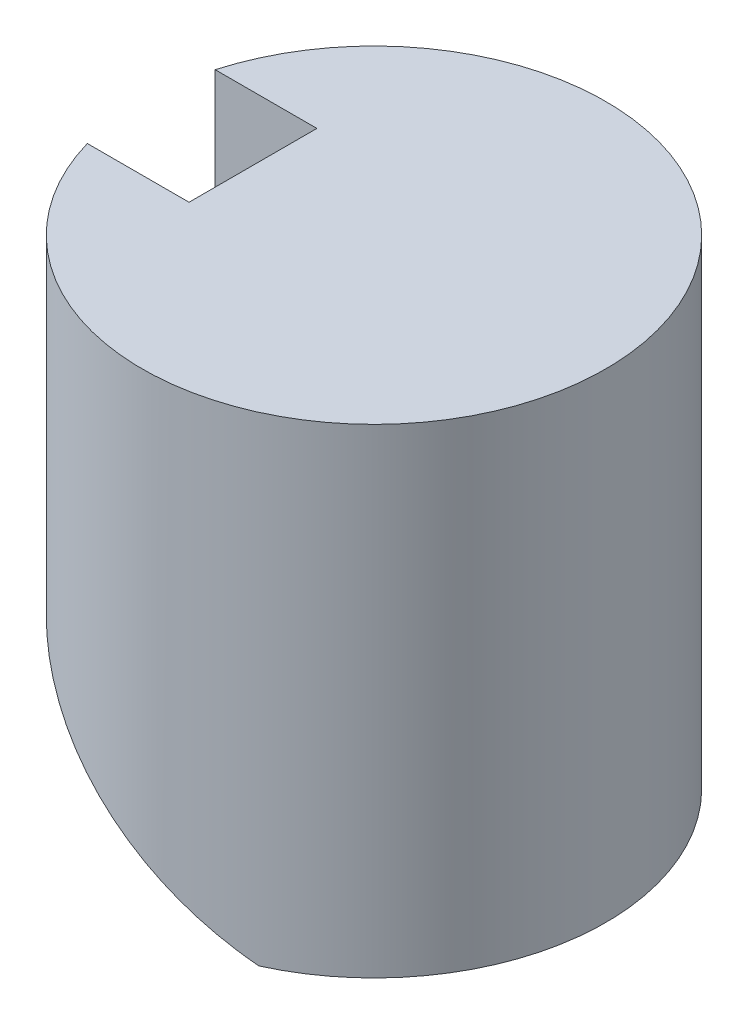
from build123d import *

# Parameters (mm, degrees)
SKETCH5_R           = 29
BOSS_EXTRUDE2_DEPTH = 60
CUT_EXTRUDE1_DEPTH  = 58
CUT_EXTRUDE3_START  = -8
CUT_EXTRUDE3_DEPTH  = 16
SKETCH10_R          = 3.5
CUT_EXTRUDE4_DEPTH  = 20


# Read off the part's stored shape, not the designer's step: Cut-Extrude3
with BuildPart() as part:
    # Sketch5 → Boss-Extrude2 (new body)
    with BuildSketch(Plane(origin=(0, 0, 0), x_dir=(1, 0, 0), z_dir=(0, 1, 0))):
        with Locations(Location((0, 0, 0), (0, 0, 270))):
            Circle(SKETCH5_R)
    extrude(amount=BOSS_EXTRUDE2_DEPTH)

    # Sketch7 → Cut-Extrude1 (cut)
    with BuildSketch(Plane.XY.offset(29)):
        Polygon((12, 0), (-29, 23.671361037), (-29, 0), align=None)
    extrude(amount=-CUT_EXTRUDE1_DEPTH, mode=Mode.SUBTRACT)

    # Cut-Extrude3 outline → Cut-Extrude3 (cut)
    with BuildSketch(Plane.XY.offset(CUT_EXTRUDE3_START)):
        Polygon((-29, 23.671361037), (-15.143593539, 15.671361037), (-15.143593539, 60), (-30, 60), (-30, 24.248711306), align=None)
    extrude(amount=CUT_EXTRUDE3_DEPTH, mode=Mode.SUBTRACT)

    # Sketch10 → Cut-Extrude4 (cut)
    with BuildSketch(Plane.XZ):
        with Locations(Location((21, 0, 0), (0, 0, 270))):
            Circle(SKETCH10_R)
    extrude(amount=-CUT_EXTRUDE4_DEPTH, mode=Mode.SUBTRACT)


solid = part.part
